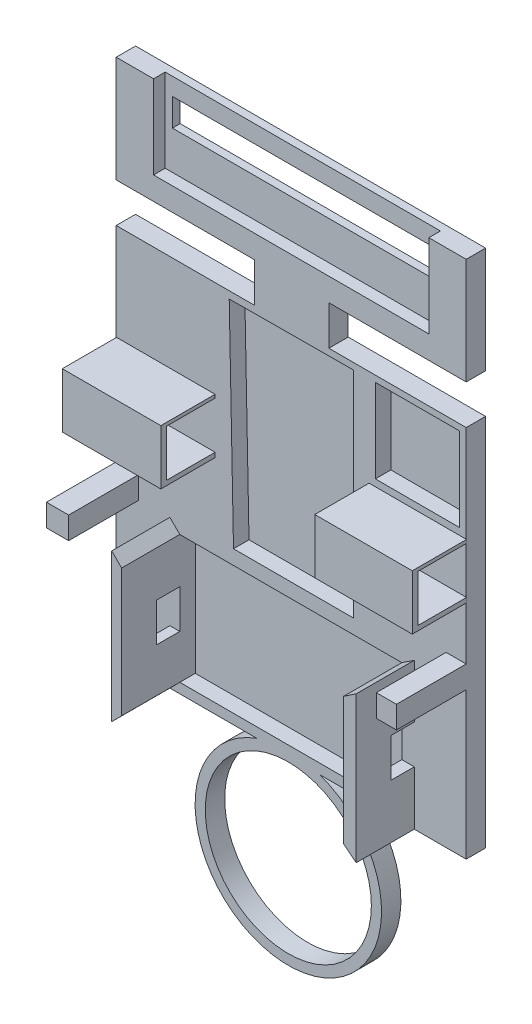
from build123d import *

# Parameters (mm, degrees)
BASE_SEGUIDOR_DEPTH        = 5
RESIZE_BASE_BY             = 10.718934909
RESIZE_BASE_2_BY           = 6.304160727
MOVER_START                = -87.004758572
MOVER_FACE10_OUTLINE_W     = 90.28944226
MOVER_FACE10_OUTLINE_H     = 5
MOVER_FACE10_DEPTH         = 4.845951812
ESBO_O27_W                 = 5.735972996
ESBO_O27_H                 = 5.741390801
ESBO_O27_W_2               = 5.190846063
BASE_ENGERENAGEM_DEPTH     = 18
ESBO_O18_R                 = 24.046540625
ESBO_O18_R_2               = 21.423073694
RESSALTO_EXTRUS_O11_DEPTH  = 5
ESBO_O22_W                 = 57.28918899
ESBO_O22_H                 = 33.028358432
CORTE_EXTRUS_O2_DEPTH      = 4
RESSALTO_EXTRUS_O12_DEPTH  = 15
ESBO_O26_W                 = 5.982118077
ESBO_O26_H                 = 10.002665269
CORTE_EXTRUS_O3_DEPTH      = 64
ESBO_O6_W                  = 25.148684125
ESBO_O6_H                  = 14.153877123
ESBO_O6_W_2                = 25.424126456
RESSALTO_EXTRUS_O10_DEPTH  = 14
ESBO_O19_W                 = 12.585961191
ESBO_O19_H                 = 12.087029767
CORTE_EXTRUS_O1_DEPTH      = 92
ESBO_O4_W                  = 21.689466083
ESBO_O4_H                  = 21.567386105
PCB_BURACOS_DEPTH          = 4
ESBO_O2_W                  = 71.017341725
ESBO_O2_H                  = 21.492860186
SENSOR_INFRA_ENCAIXE_DEPTH = 3
ESBO_O9_W                  = 67.154361664
ESBO_O9_H                  = 7.082446002
FURO_SENSOR_DEPTH          = 10


# Read off the part's stored shape, not the designer's step: Mover face10
with BuildPart() as part:
    # Esboço1 → base_seguidor (new body)
    with BuildSketch(Plane.XY):
        Polygon((-44.67348187, 40.715072084), (-44.67348187, 19.603553226), (-9.047793796, 19.603553226), (-9.047793796, 9.424785205), (-44.67348187, 9.424785205), (-44.67348187, -71.439871851), (45.61596039, -71.439871851), (45.61596039, 9.424785205), (10.178768021, 9.424785205), (10.178768021, 19.603553226), (45.61596039, 19.603553226), (45.61596039, 40.715072084), align=None)
    extrude(amount=BASE_SEGUIDOR_DEPTH)

    # resize_base: a face moved outward by 10.718935
    extrude(part.faces().sort_by_distance((0.47123926, -71.439871851, 2.5))[0], amount=RESIZE_BASE_BY, dir=(0, -1, 0))

    # resize_base_2: a face moved outward by 6.304161
    extrude(part.faces().sort_by_distance((0.47123926, 40.715072084, 2.5))[0], amount=RESIZE_BASE_2_BY, dir=(0, 1, 0))

    # Mover face10 outline → Mover face10 (add)
    with BuildSketch(Plane(origin=(0, 0, 0), x_dir=(1, 0, 0), z_dir=(0, 1, 0)).offset(MOVER_START)):
        with Locations((0.47123926, -2.5)):
            Rectangle(MOVER_FACE10_OUTLINE_W, MOVER_FACE10_OUTLINE_H)
    extrude(amount=MOVER_FACE10_DEPTH)

    # Esboço27 → base_engerenagem (add)
    with BuildSketch(Plane.XY.offset(5)):
        with Locations((-41.805495372, -46.264886582)):
            Rectangle(ESBO_O27_W, ESBO_O27_H)
        with Locations((43.020537359, -46.264886582)):
            Rectangle(ESBO_O27_W_2, ESBO_O27_H)
    extrude(amount=BASE_ENGERENAGEM_DEPTH)

    # Esboço18 → Ressalto-extrusão11 (add)
    with BuildSketch(Plane.XY.offset(5)):
        with Locations((-0.274583628, -109.638466508)):
            Circle(ESBO_O18_R)
        with Locations((-0.274583628, -109.638466508)):
            Circle(ESBO_O18_R_2, mode=Mode.SUBTRACT)
    extrude(amount=-RESSALTO_EXTRUS_O11_DEPTH)

    # Esboço22 → Corte-extrusão2 (cut)
    with BuildSketch(Plane.XY.offset(5)):
        with Locations((0.373700248, -67.914265776)):
            Rectangle(ESBO_O22_W, ESBO_O22_H)
    extrude(amount=-CORTE_EXTRUS_O2_DEPTH, mode=Mode.SUBTRACT)

    # Esboço24 → Ressalto-extrusão12 (add)
    with BuildSketch(Plane.XY.offset(5)):
        Polygon((-28.270894247, -51.40008656), (-30.823687143, -48.847293665), (-30.823687143, -87.004758572), (-28.270894247, -84.428444992), align=None)
        Polygon((29.018294743, -51.40008656), (32.214208361, -49.269582228), (32.214208361, -87.004758572), (29.018294743, -84.428444992), align=None)
    extrude(amount=RESSALTO_EXTRUS_O12_DEPTH)

    # Esboço26 → Corte-extrusão3 (cut)
    with BuildSketch(Plane(origin=(32.214208361, 0, 0), x_dir=(0, 0, -1), z_dir=(1, 0, 0))):
        with Locations((-7.991059039, -68.064198105)):
            Rectangle(ESBO_O26_W, ESBO_O26_H)
    extrude(amount=-CORTE_EXTRUS_O3_DEPTH, mode=Mode.SUBTRACT)

    # Esboço6 → Ressalto-extrusão10 (add)
    with BuildSketch(Plane.XY.offset(5)):
        with Locations((33.131077051, -22.60517657)):
            Rectangle(ESBO_O6_W, ESBO_O6_H)
        with Locations((-31.871959919, -22.60517657)):
            Rectangle(ESBO_O6_W_2, ESBO_O6_H)
    extrude(amount=RESSALTO_EXTRUS_O10_DEPTH)

    # Esboço19 → Corte-extrusão1 (cut)
    with BuildSketch(Plane.ZY.offset(44.67348187)):
        with Locations((11.292980596, -22.434877547)):
            Rectangle(ESBO_O19_W, ESBO_O19_H)
    extrude(amount=-CORTE_EXTRUS_O1_DEPTH, mode=Mode.SUBTRACT)

    # Esboço4 → pcb_buracos (cut)
    with BuildSketch(Plane.XY.offset(5)):
        Polygon((-15.516819289, 7.573140349), (16.485994782, 7.741548684), (16.485994782, -47.664793519), (-14.412520449, -47.664793519), align=None)
        with Locations((33.019910346, -2.978526461)):
            Rectangle(ESBO_O4_W, ESBO_O4_H)
    extrude(amount=-PCB_BURACOS_DEPTH, mode=Mode.SUBTRACT)

    # Esboço2 → sensor_infra_encaixe (cut)
    with BuildSketch(Plane.XY.offset(5)):
        with Locations((0.47123926, 36.272802718)):
            Rectangle(ESBO_O2_W, ESBO_O2_H)
    extrude(amount=-SENSOR_INFRA_ENCAIXE_DEPTH, mode=Mode.SUBTRACT)

    # Esboço9 → furo_sensor (cut)
    with BuildSketch(Plane.XY.offset(2)):
        with Locations((0.411915335, 38.971892304)):
            Rectangle(ESBO_O9_W, ESBO_O9_H)
    extrude(amount=-FURO_SENSOR_DEPTH, mode=Mode.SUBTRACT)


solid = part.part
